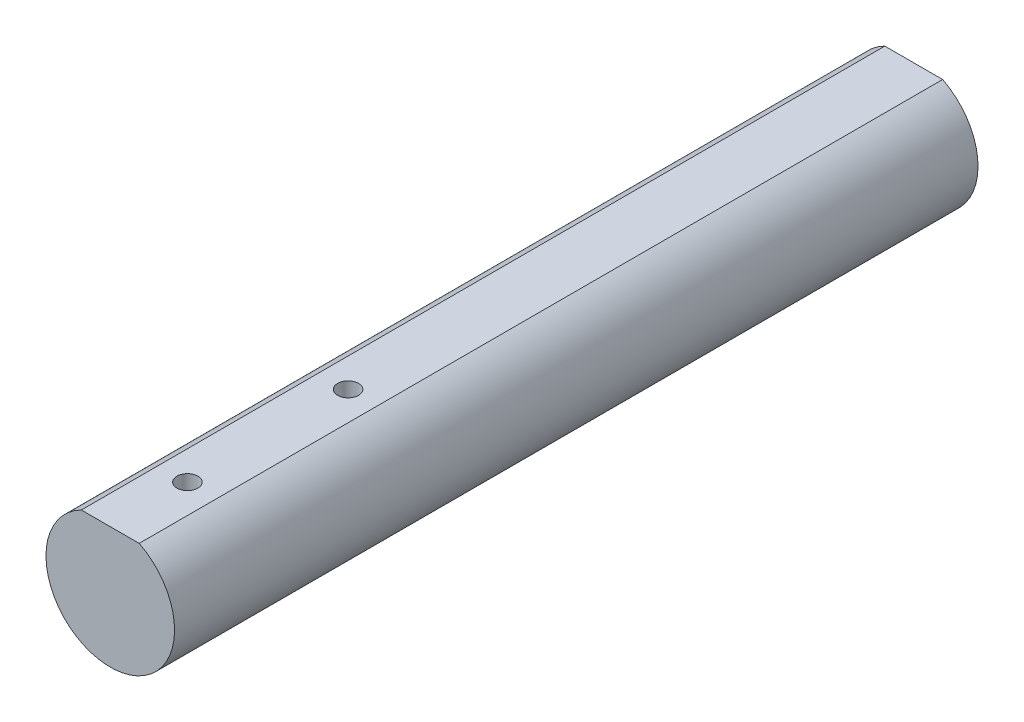
from build123d import *

# Parameters (mm, degrees)
SKETCH1_R           = 10
BOSS_EXTRUDE1_DEPTH = 62.5
SKETCH2_W           = 9
SKETCH2_H           = 5
CUT_EXTRUDE1_DEPTH  = 126.797456254
SKETCH3_R           = 1.625
CUT_EXTRUDE2_DEPTH  = 67.065162612
CUT_EXTRUDE3_START  = -8
SKETCH4_R           = 4
CUT_EXTRUDE3_DEPTH  = 150


with BuildPart() as part:
    # Sketch1 → Boss-Extrude1 (new, symmetric)
    with BuildSketch(Plane.XY):
        Circle(SKETCH1_R)
    extrude(amount=BOSS_EXTRUDE1_DEPTH, both=True)

    # Sketch2 → Cut-Extrude1 (cut, through all)
    with BuildSketch(Plane.XY.offset(62.5)):
        with Locations((0, 11.43028555)):
            Rectangle(SKETCH2_W, SKETCH2_H)
    extrude(amount=-CUT_EXTRUDE1_DEPTH, mode=Mode.SUBTRACT)

    # Sketch3 → Cut-Extrude2 (cut, through all)
    with BuildSketch(Plane(origin=(0, 8.93028555, 0), x_dir=(1, 0, 0), z_dir=(0, 1, 0))):
        with Locations((0, -50.5)):
            Circle(SKETCH3_R)
        with Locations((0, -25.5)):
            Circle(SKETCH3_R)
    extrude(amount=-CUT_EXTRUDE2_DEPTH, mode=Mode.SUBTRACT)

    # Sketch4 → Cut-Extrude3 (cut)
    with BuildSketch(Plane(origin=(0, 8.93028555, 0), x_dir=(1, 0, 0), z_dir=(0, 1, 0)).offset(CUT_EXTRUDE3_START)):
        with Locations((0, -25.5)):
            Circle(SKETCH4_R)
        with Locations((0, -50.5)):
            Circle(SKETCH4_R)
    extrude(amount=-CUT_EXTRUDE3_DEPTH, mode=Mode.SUBTRACT)


solid = part.part
